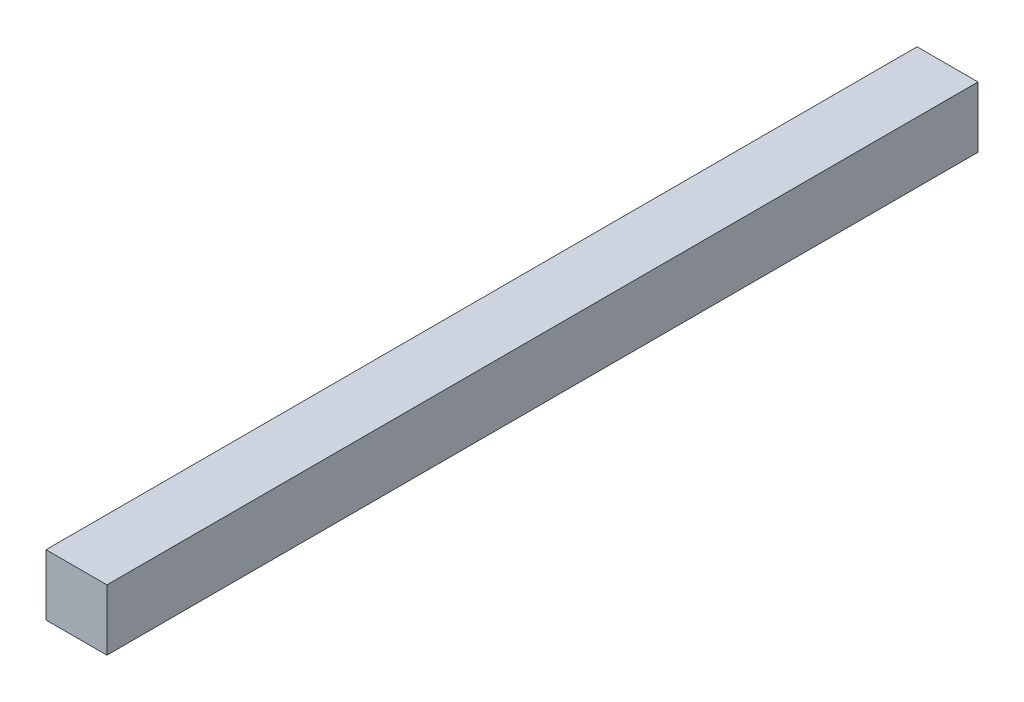
from build123d import *

# Parameters (mm, degrees)
SZKIC1_W                    = 10
SZKIC1_H                    = 10
DODANIE_WYCI_GNI_CIE1_DEPTH = 143


with BuildPart() as part:
    # Szkic1 → Dodanie-wyciągnięcie1 (new body)
    with BuildSketch(Plane.XY):
        Rectangle(SZKIC1_W, SZKIC1_H)
    extrude(amount=DODANIE_WYCI_GNI_CIE1_DEPTH)


solid = part.part
